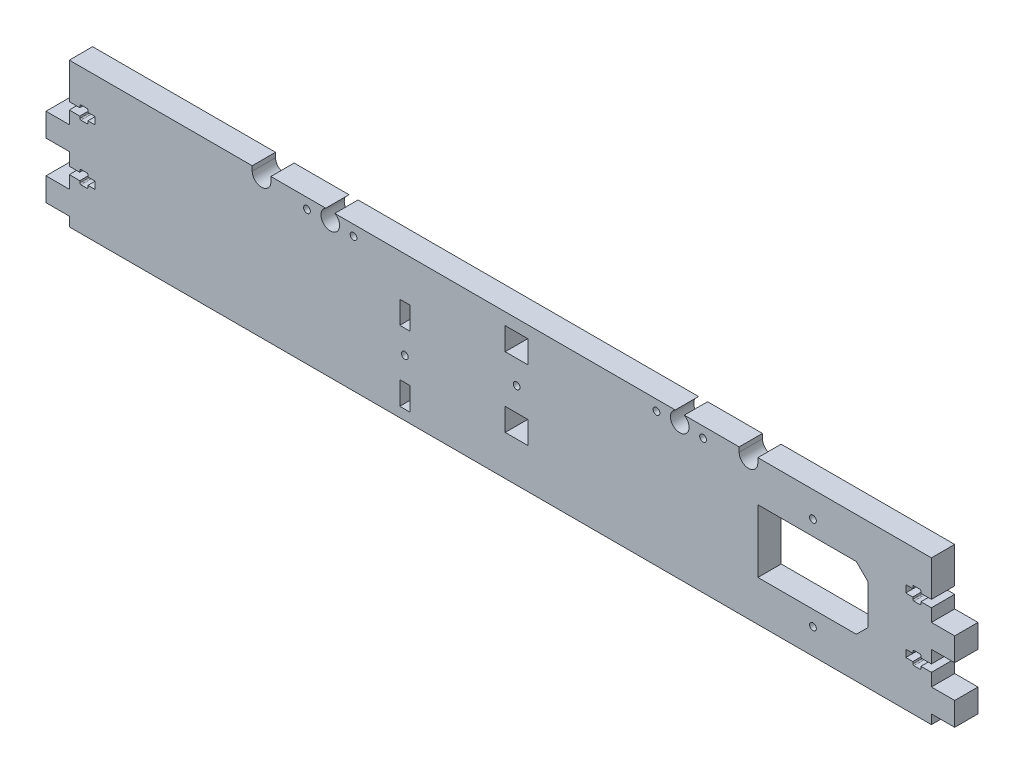
from build123d import *

# Parameters (mm, degrees)
MAINBODY_DEPTH      = 10
SCREWCUTOUTS_DEPTH  = 205.863369102
SKETCH2_R           = 4
SKETCH2_R_2         = 1.45
RODCUTOUTS_DEPTH    = 205.863369102
SKETCH4_R           = 1.45
SKETCH4_W           = 9.85
SKETCH4_H           = 9.7
CUT_EXTRUDE3_DEPTH  = 205.863369102
SKETCH5_R           = 1.45
SKETCH5_W           = 4.35
SKETCH5_H           = 9.7
SKETCH5_H_2         = 9.9
ENDSTOPHOLDER_DEPTH = 205.863369102
CUT_EXTRUDE4_DEPTH  = 205.863369102
CUT_EXTRUDE5_DEPTH  = 205.863369102
SKETCH9_R           = 1.45
CUT_EXTRUDE6_DEPTH  = 205.863369102


with BuildPart() as part:
    # Sketch1 → MainBody (new body)
    with BuildSketch(Plane.XY):
        Polygon((0, 0), (-185, 0), (-185, -24), (-195, -24), (-195, -34), (-185, -34), (-185, -48), (-195, -48), (-195, -58), (-185, -58), (-185, -62), (0, -62), align=None)
    mainbody = extrude(amount=MAINBODY_DEPTH)

    # Sketch3 → ScrewCutouts (cut, through all)
    with BuildSketch(Plane.XY.offset(10)):
        with BuildLine():
            Line((-185, -18.55), (-180.5, -18.55))
            Line((-180.5, -18.55), (-180.5, -19.35))
            ThreePointArc((-180.5, -19.35), (-180.353553391, -19.703553391), (-180, -19.85))
            Line((-180, -19.85), (-177.5, -19.85))
            ThreePointArc((-177.5, -19.85), (-177.146446609, -19.703553391), (-177, -19.35))
            Line((-177, -19.35), (-177, -18.55))
            Line((-177, -18.55), (-174, -18.55))
            Line((-174, -18.55), (-174, -15.45))
            Line((-174, -15.45), (-177, -15.45))
            Line((-177, -15.45), (-177, -14.65))
            ThreePointArc((-177, -14.65), (-177.146446609, -14.296446609), (-177.5, -14.15))
            Line((-177.5, -14.15), (-180, -14.15))
            ThreePointArc((-180, -14.15), (-180.353553391, -14.296446609), (-180.5, -14.65))
            Line((-180.5, -14.65), (-180.5, -15.45))
            Line((-180.5, -15.45), (-185, -15.45))
            Line((-185, -15.45), (-185, -18.55))
        make_face()
        with BuildLine():
            Line((-185, -39.45), (-185, -42.55))
            Line((-185, -42.55), (-180.5, -42.55))
            Line((-180.5, -42.55), (-180.5, -43.35))
            ThreePointArc((-180.5, -43.35), (-180.353553391, -43.703553391), (-180, -43.85))
            Line((-180, -43.85), (-177.5, -43.85))
            ThreePointArc((-177.5, -43.85), (-177.146446609, -43.703553391), (-177, -43.35))
            Line((-177, -43.35), (-177, -42.55))
            Line((-177, -42.55), (-174, -42.55))
            Line((-174, -42.55), (-174, -39.45))
            Line((-174, -39.45), (-177, -39.45))
            Line((-177, -39.45), (-177, -38.65))
            ThreePointArc((-177, -38.65), (-177.146446609, -38.296446609), (-177.5, -38.15))
            Line((-177.5, -38.15), (-180, -38.15))
            ThreePointArc((-180, -38.15), (-180.353553391, -38.296446609), (-180.5, -38.65))
            Line((-180.5, -38.65), (-180.5, -39.45))
            Line((-180.5, -39.45), (-185, -39.45))
        make_face()
    screwcutouts = extrude(amount=-SCREWCUTOUTS_DEPTH, mode=Mode.SUBTRACT)

    # Mirror1: MainBody, ScrewCutouts across plane
    add(mainbody.mirror(Plane(origin=(0, 0, 0), x_dir=(0, 0, 1), z_dir=(1, 0, 0))))
    add(screwcutouts.mirror(Plane(origin=(0, 0, 0), x_dir=(0, 0, 1), z_dir=(1, 0, 0))), mode=Mode.SUBTRACT)

    # Sketch2 → RodCutouts (cut, through all)
    with BuildSketch(Plane.XY.offset(10)):
        with Locations((-73, -3.5)):
            Circle(SKETCH2_R)
        with Locations((-83, -4.5)):
            Circle(SKETCH2_R_2)
        with Locations((-63, -4.5)):
            Circle(SKETCH2_R_2)
        with Locations((67, -4.5)):
            Circle(SKETCH2_R_2)
        with Locations((87, -4.5)):
            Circle(SKETCH2_R_2)
        with Locations((77, -3.5)):
            Circle(SKETCH2_R)
    extrude(amount=-RODCUTOUTS_DEPTH, mode=Mode.SUBTRACT)

    # Sketch4 → Cut-Extrude3 (cut, through all)
    with BuildSketch(Plane.XY.offset(10)):
        with Locations((7, -25)):
            Circle(SKETCH4_R)
        with Locations((7, -10)):
            Rectangle(SKETCH4_W, SKETCH4_H)
        with Locations((7, -40)):
            Rectangle(SKETCH4_W, SKETCH4_H)
    extrude(amount=-CUT_EXTRUDE3_DEPTH, mode=Mode.SUBTRACT)

    # Sketch5 → EndstopHolder (cut, through all)
    with BuildSketch(Plane.XY.offset(10)):
        with Locations((-41, -37.75)):
            Circle(SKETCH5_R)
        with Locations((-41, -22.8)):
            Rectangle(SKETCH5_W, SKETCH5_H)
        with Locations((-41, -52.8)):
            Rectangle(SKETCH5_W, SKETCH5_H_2)
        with BuildLine():
            Line((-31.425, 8.994431211), (-31.425, 5))
            ThreePointArc((-31.425, 5), (-34.625, 1.8), (-37.825, 5))
            Line((-37.825, 5), (-37.825, 8.994431211))
            ThreePointArc((-37.825, 8.994431211), (-34.625, 12.194431211), (-31.425, 8.994431211))
        make_face()
    extrude(amount=-ENDSTOPHOLDER_DEPTH, mode=Mode.SUBTRACT)

    # Sketch7 → Cut-Extrude4 (cut, through all)
    with BuildSketch(Plane.XY.offset(10)):
        with BuildLine():
            Line((-98.5, 0), (-98.5, -2))
            ThreePointArc((-98.5, -2), (-102.5, -6), (-106.5, -2))
            Line((-106.5, -2), (-106.5, 0))
            ThreePointArc((-106.5, 0), (-102.5, 4), (-98.5, 0))
        make_face()
        with BuildLine():
            Line((102.5, 0), (102.5, -2))
            ThreePointArc((102.5, -2), (106.5, -6), (110.5, -2))
            Line((110.5, -2), (110.5, 0))
            ThreePointArc((110.5, 0), (106.5, 4), (102.5, 0))
        make_face()
    extrude(amount=-CUT_EXTRUDE4_DEPTH, mode=Mode.SUBTRACT)

    # Sketch8 → Cut-Extrude5 (cut, through all)
    with BuildSketch(Plane.XY.offset(10)):
        Polygon((110.536074356, -17.485), (110.536074356, -44.515), (152.786074356, -44.515), (157.786074356, -39.515), (157.786074356, -22.485), (152.786074356, -17.485), align=None)
    extrude(amount=-CUT_EXTRUDE5_DEPTH, mode=Mode.SUBTRACT)

    # Sketch9 → Cut-Extrude6 (cut, through all)
    with BuildSketch(Plane(origin=(0, 0, 0), x_dir=(-1, 0, 0), z_dir=(0, 0, -1))):
        with Locations((-134.161074356, -11)):
            Circle(SKETCH9_R)
        with Locations((-134.161074356, -51)):
            Circle(SKETCH9_R)
    extrude(amount=-CUT_EXTRUDE6_DEPTH, mode=Mode.SUBTRACT)


solid = part.part
